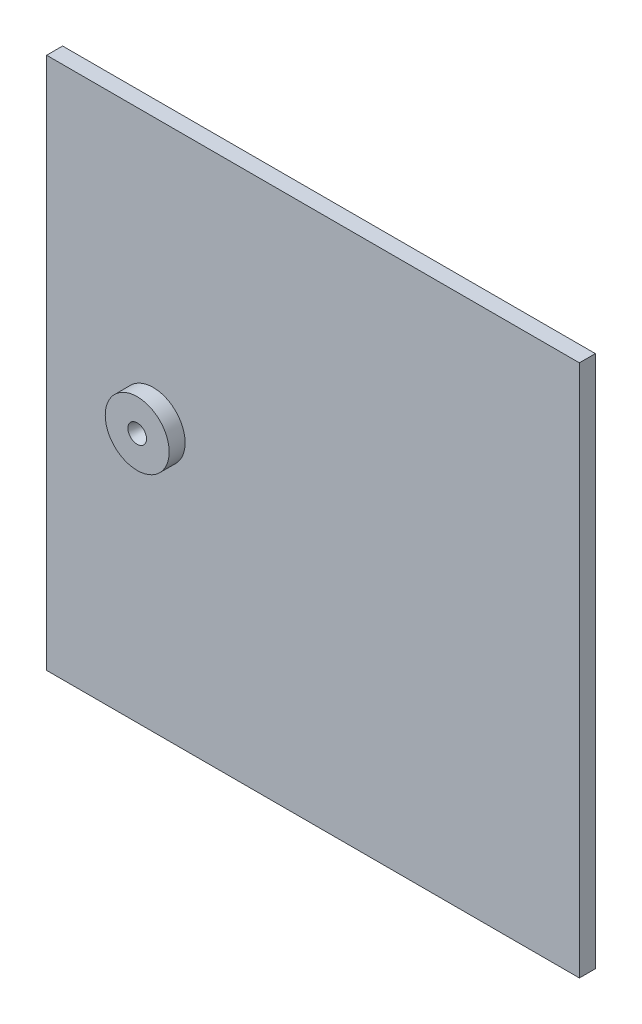
from build123d import *
from OCP.BRepFilletAPI import BRepFilletAPI_MakeChamfer

# Parameters (mm, degrees)
SKETCH1_W           = 100
SKETCH1_H           = 100
BOSS_EXTRUDE1_DEPTH = 3
SKETCH2_R           = 6.25
BOSS_EXTRUDE2_DEPTH = 30
SKETCH3_R           = 0.75
CUT_EXTRUDE1_DEPTH  = 145.568322948
SKETCH4_R           = 6
SKETCH4_R_2         = 0.75
BOSS_EXTRUDE3_DEPTH = 3
CHAMFER1_SIZE       = 1
CHAMFER1_SIZE_2     = 3


with BuildPart() as part:
    # Sketch1 → Boss-Extrude1 (new body)
    with BuildSketch(Plane.XY):
        with Locations((50, 50)):
            Rectangle(SKETCH1_W, SKETCH1_H)
    extrude(amount=BOSS_EXTRUDE1_DEPTH)

    # Sketch2 → Boss-Extrude2 (add)
    with BuildSketch(Plane.XY.offset(3)):
        with Locations((20, 50)):
            Circle(SKETCH2_R)
    extrude(amount=-BOSS_EXTRUDE2_DEPTH)

    # Sketch3 → Cut-Extrude1 (cut, through all)
    with BuildSketch(Plane(origin=(0, 0, -27), x_dir=(-1, 0, 0), z_dir=(0, 0, -1))):
        with Locations((-20, 50)):
            Circle(SKETCH3_R)
    extrude(amount=-CUT_EXTRUDE1_DEPTH, mode=Mode.SUBTRACT)

    # Sketch4 → Boss-Extrude3 (add)
    with BuildSketch(Plane.XY.offset(3)):
        with Locations(Location((20, 50, 0), (0, 0, 180))):
            Circle(SKETCH4_R)
        with Locations(Location((20, 50, 0), (0, 0, 180))):
            Circle(SKETCH4_R_2, mode=Mode.SUBTRACT)
    extrude(amount=BOSS_EXTRUDE3_DEPTH)

    # Chamfer1
    chamfer1_edges_1 = [part.edges().sort_by_distance(p)[0] for p in [
        (20.75, 50, -27),
    ]]
    chamfer1_side_1 = [part.faces().sort_by_distance(p)[0] for p in [
        (20.77, 50, -27),
    ]]
    chamfer1_edges_2 = [part.edges().sort_by_distance(p)[0] for p in [
        (20.75, 50, 6),
    ]]
    chamfer1_side_2 = [part.faces().sort_by_distance(p)[0] for p in [
        (20.77, 50, 6),
    ]]
    chamfer1 = BRepFilletAPI_MakeChamfer(part.part.solid().wrapped)
    for e in chamfer1_edges_1:
        chamfer1.Add(CHAMFER1_SIZE - 0.0001, CHAMFER1_SIZE_2 - 0.0001, e.wrapped, chamfer1_side_1[0].wrapped)
    for e in chamfer1_edges_2:
        chamfer1.Add(CHAMFER1_SIZE - 0.0001, CHAMFER1_SIZE_2 - 0.0001, e.wrapped, chamfer1_side_2[0].wrapped)
    add(Compound.cast(chamfer1.Shape()), mode=Mode.REPLACE)  # a hair under: the kernel refuses the full size


solid = part.part
